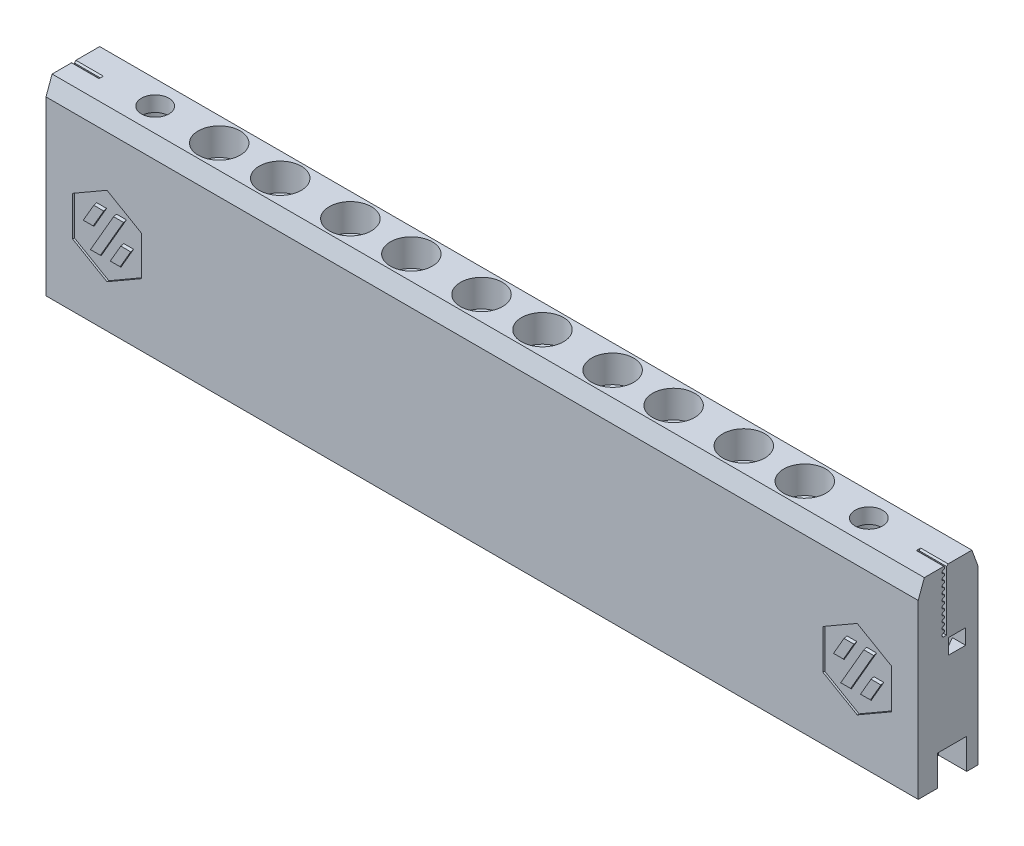
from build123d import *
from build123d.topology import SkipClean

# Parameters (mm, degrees)
SKIZZE1_W                        = 286
SKIZZE1_H                        = 19.6
SKIZZE1_R                        = 4.5
SKIZZE1_R_2                      = 4.2
AUFSATZ_LINEAR_AUSTRAGEN1_DEPTH  = 31
SKIZZE2_W                        = 9.2
SKIZZE2_H                        = 9.64
SCHNITT_LINEAR_AUSTRAGEN1_DEPTH  = 20
SKIZZE3_R                        = 1.65
SCHNITT_LINEAR_AUSTRAGEN2_DEPTH  = 11
FASE1_SIZE                       = 2
FASE1_SIZE2                      = 5.494954839
SKIZZE8_R                        = 6.9
SCHNITT_LINEAR_AUSTRAGEN6_DEPTH  = 9
SCHNITT_LINEAR_START             = -15
SCHNITT_LINEAR_AUSTRAGEN7_DEPTH  = 47
SKIZZE13_R                       = 7.65
SCHNITT_LINEAR_AUSTRAGEN10_DEPTH = 57
AUFSATZ_LINEAR_START             = -0.4
SKIZZE17_R                       = 4.2
AUFSATZ_LINEAR_AUSTRAGEN2_DEPTH  = 0.4
SKIZZE19_W                       = 9.2
SKIZZE19_H                       = 9.64
SKIZZE19_R                       = 1.65
AUFSATZ_LINEAR_AUSTRAGEN3_DEPTH  = 20
SCHNITT_LINEAR_AUSTRAGEN14_DEPTH = 9
SCHNITT_LINEAR_START_2           = -9
SCHNITT_LINEAR_AUSTRAGEN15_DEPTH = 9
SKIZZE25_R                       = 1.65
AUFSATZ_LINEAR_AUSTRAGEN4_DEPTH  = 17
SCHNITT_LINEAR_AUSTRAGEN16_DEPTH = 0.6
FASE2_SIZE                       = 0.6
FASE3_SIZE                       = 0.5
SKIZZE27_R                       = 2.25
SCHNITT_LINEAR_AUSTRAGEN17_DEPTH = 15
SKIZZE28_W                       = 9.2
SKIZZE28_H                       = 9.64
SKIZZE28_R                       = 1.65
AUFSATZ_LINEAR_AUSTRAGEN5_DEPTH  = 10
SCHNITT_LINEAR_START_3           = -3
SCHNITT_LINEAR_AUSTRAGEN18_DEPTH = 28
SCHNITT_LINEAR_AUSTRAGEN19_DEPTH = 5
AUFSATZ_LINEAR_START_2           = -4
SKIZZE31_R                       = 1.65
AUFSATZ_LINEAR_AUSTRAGEN6_DEPTH  = 4
FASE4_SIZE                       = 1.6


# Some blends are built 0.0001 mm under size
with BuildPart() as part:
    # Skizze1 → Aufsatz-Linear austragen1 (new body)
    with BuildSketch(Plane(origin=(0, 0, 0), x_dir=(1, 0, 0), z_dir=(0, 1, 0))):
        with Locations((143, 9.8)):
            Rectangle(SKIZZE1_W, SKIZZE1_H)
        with Locations(Location((26, 9.8, 0), (0, 0, 270))):
            Circle(SKIZZE1_R, mode=Mode.SUBTRACT)
        with Locations(Location((260, 9.8, 0), (0, 0, 90))):
            Circle(SKIZZE1_R, mode=Mode.SUBTRACT)
        with Locations(Location((47, 9.8, 0), (0, 0, 270))):
            Circle(SKIZZE1_R_2, mode=Mode.SUBTRACT)
        with Locations(Location((239, 9.8, 0), (0, 0, 90))):
            Circle(SKIZZE1_R_2, mode=Mode.SUBTRACT)
        with Locations(Location((67, 9.8, 0), (0, 0, 270))):
            Circle(SKIZZE1_R_2, mode=Mode.SUBTRACT)
        with Locations(Location((219, 9.8, 0), (0, 0, 90))):
            Circle(SKIZZE1_R_2, mode=Mode.SUBTRACT)
        with Locations(Location((90, 9.8, 0), (0, 0, 270))):
            Circle(SKIZZE1_R_2, mode=Mode.SUBTRACT)
        with Locations(Location((110, 9.8, 0), (0, 0, 270))):
            Circle(SKIZZE1_R_2, mode=Mode.SUBTRACT)
        with Locations(Location((133, 9.8, 0), (0, 0, 270))):
            Circle(SKIZZE1_R_2, mode=Mode.SUBTRACT)
        with Locations(Location((153, 9.8, 0), (0, 0, 90))):
            Circle(SKIZZE1_R_2, mode=Mode.SUBTRACT)
        with Locations(Location((176, 9.8, 0), (0, 0, 90))):
            Circle(SKIZZE1_R_2, mode=Mode.SUBTRACT)
        with Locations(Location((196, 9.8, 0), (0, 0, 90))):
            Circle(SKIZZE1_R_2, mode=Mode.SUBTRACT)
    aufsatz_linear_austragen1 = extrude(amount=AUFSATZ_LINEAR_AUSTRAGEN1_DEPTH)

    # Skizze2 → Schnitt-Linear austragen1 (cut)
    with BuildSketch(Plane(origin=(0, 31, 0), x_dir=(1, 0, 0), z_dir=(0, 1, 0))):
        with Locations((4.6, 11.08)):
            Rectangle(SKIZZE2_W, SKIZZE2_H)
        with Locations((281.4, 11.08)):
            Rectangle(SKIZZE2_W, SKIZZE2_H)
    schnitt_linear_austragen1 = extrude(amount=-SCHNITT_LINEAR_AUSTRAGEN1_DEPTH, mode=Mode.SUBTRACT)

    # Skizze3 → Schnitt-Linear austragen2 (cut)
    with BuildSketch(Plane(origin=(0, 11, 0), x_dir=(1, 0, 0), z_dir=(0, 1, 0))):
        with Locations(Location((6, 12.7, 0), (0, 0, 270))):
            Circle(SKIZZE3_R)
        with Locations(Location((280, 12.7, 0), (0, 0, 90))):
            Circle(SKIZZE3_R)
    schnitt_linear_austragen2 = extrude(amount=-SCHNITT_LINEAR_AUSTRAGEN2_DEPTH, mode=Mode.SUBTRACT)

    # Spiegeln3: Aufsatz-Linear austragen1, Schnitt-Linear austragen1, Schnitt-Linear austragen2 across plane
    add(aufsatz_linear_austragen1.mirror(Plane(origin=(0, 0, -19.6), x_dir=(0, 0, 1), z_dir=(0, -1, 0))))
    add(schnitt_linear_austragen1.mirror(Plane(origin=(0, 0, -19.6), x_dir=(0, 0, 1), z_dir=(0, -1, 0))), mode=Mode.SUBTRACT)
    add(schnitt_linear_austragen2.mirror(Plane(origin=(0, 0, -19.6), x_dir=(0, 0, 1), z_dir=(0, -1, 0))), mode=Mode.SUBTRACT)

    # Fase1
    fase1_edges = [part.edges().sort_by_distance(p)[0] for p in [
        (143, 31, -19.6),
        (143, 31, 0),
    ]]
    fase1_side = [part.faces().sort_by_distance(p)[0] for p in [
        (143, 31, -9.75216974),
    ]]
    chamfer(fase1_edges, length=FASE1_SIZE, length2=FASE1_SIZE2, reference=fase1_side[0])

    # Skizze8 → Schnitt-Linear austragen6 (cut)
    with BuildSketch(Plane(origin=(0, 31, 0), x_dir=(1, 0, 0), z_dir=(0, 1, 0))):
        with Locations(Location((47, 9.8, 0), (0, 0, 270))):
            Circle(SKIZZE8_R)
        with Locations(Location((67, 9.8, 0), (0, 0, 270))):
            Circle(SKIZZE8_R)
        with Locations(Location((219, 9.8, 0), (0, 0, 270))):
            Circle(SKIZZE8_R)
        with Locations(Location((239, 9.8, 0), (0, 0, 270))):
            Circle(SKIZZE8_R)
        with Locations(Location((90, 9.8, 0), (0, 0, 270))):
            Circle(SKIZZE8_R)
        with Locations(Location((110, 9.8, 0), (0, 0, 270))):
            Circle(SKIZZE8_R)
        with Locations(Location((133, 9.8, 0), (0, 0, 270))):
            Circle(SKIZZE8_R)
        with Locations(Location((153, 9.8, 0), (0, 0, 270))):
            Circle(SKIZZE8_R)
        with Locations(Location((176, 9.8, 0), (0, 0, 270))):
            Circle(SKIZZE8_R)
        with Locations(Location((196, 9.8, 0), (0, 0, 270))):
            Circle(SKIZZE8_R)
    extrude(amount=-SCHNITT_LINEAR_AUSTRAGEN6_DEPTH, mode=Mode.SUBTRACT)

    # Skizze9 → Schnitt-Linear austragen7 (cut)
    with BuildSketch(Plane(origin=(0, 31, 0), x_dir=(1, 0, 0), z_dir=(0, 1, 0)).offset(SCHNITT_LINEAR_START)):
        Polygon((42.092522712, 18.3), (71.907477288, 18.3), (76.814954576, 9.8), (71.907477288, 1.3), (42.092522712, 1.3), (37.185045424, 9.8), align=None)
        Polygon((85.092522712, 18.3), (114.907477288, 18.3), (119.814954576, 9.8), (114.907477288, 1.3), (85.092522712, 1.3), (80.185045424, 9.8), align=None)
        Polygon((214.092522712, 18.3), (243.907477288, 18.3), (248.814954576, 9.8), (243.907477288, 1.3), (214.092522712, 1.3), (209.185045424, 9.8), align=None)
        Polygon((128.092522712, 18.3), (157.907477288, 18.3), (162.814954576, 9.8), (157.907477288, 1.3), (128.092522712, 1.3), (123.185045424, 9.8), align=None)
        Polygon((171.092522712, 18.3), (200.907477288, 18.3), (205.814954576, 9.8), (200.907477288, 1.3), (171.092522712, 1.3), (166.185045424, 9.8), align=None)
    extrude(amount=-SCHNITT_LINEAR_AUSTRAGEN7_DEPTH, mode=Mode.SUBTRACT)

    # Skizze13 → Schnitt-Linear austragen10 (cut)
    with BuildSketch(Plane.XZ.offset(31)):
        with Locations(Location((26, -9.8, 0), (0, 0, 270))):
            Circle(SKIZZE13_R)
        with Locations(Location((260, -9.8, 0), (0, 0, 270))):
            Circle(SKIZZE13_R)
    extrude(amount=-SCHNITT_LINEAR_AUSTRAGEN10_DEPTH, mode=Mode.SUBTRACT)

    # Skizze17 → Aufsatz-Linear austragen2 (add)
    with BuildSketch(Plane(origin=(0, 22, 0), x_dir=(1, 0, 0), z_dir=(0, 1, 0)).offset(AUFSATZ_LINEAR_START)):
        with Locations(Location((47, 9.8, 0), (0, 0, 90))):
            Circle(SKIZZE17_R)
        with Locations(Location((67, 9.8, 0), (0, 0, 90))):
            Circle(SKIZZE17_R)
        with Locations(Location((90, 9.8, 0), (0, 0, 90))):
            Circle(SKIZZE17_R)
        with Locations(Location((110, 9.8, 0), (0, 0, 90))):
            Circle(SKIZZE17_R)
        with Locations(Location((133, 9.8, 0), (0, 0, 90))):
            Circle(SKIZZE17_R)
        with Locations(Location((153, 9.8, 0), (0, 0, 90))):
            Circle(SKIZZE17_R)
        with Locations(Location((176, 9.8, 0), (0, 0, 90))):
            Circle(SKIZZE17_R)
        with Locations(Location((196, 9.8, 0), (0, 0, 90))):
            Circle(SKIZZE17_R)
        with Locations(Location((219, 9.8, 0), (0, 0, 90))):
            Circle(SKIZZE17_R)
        with Locations(Location((239, 9.8, 0), (0, 0, 90))):
            Circle(SKIZZE17_R)
    extrude(amount=AUFSATZ_LINEAR_AUSTRAGEN2_DEPTH)

    # Skizze19 → Aufsatz-Linear austragen3 (add)
    # profile 1 of 2: a face of its own
    with BuildSketch(Plane(origin=(0, 31, 0), x_dir=(1, 0, 0), z_dir=(0, 1, 0))):
        with Locations((4.6, 11.08)):
            Rectangle(SKIZZE19_W, SKIZZE19_H)
        with Locations(Location((6, 12.7, 0), (0, 0, 270))):
            Circle(SKIZZE19_R, mode=Mode.SUBTRACT)
    # profile 2 of 2: a face of its own
    with BuildSketch(Plane(origin=(0, 31, 0), x_dir=(1, 0, 0), z_dir=(0, 1, 0))):
        with Locations((281.4, 11.08)):
            Rectangle(SKIZZE19_W, SKIZZE19_H)
        with Locations(Location((280, 12.7, 0), (0, 0, 270))):
            Circle(SKIZZE19_R, mode=Mode.SUBTRACT)
    extrude(amount=-AUFSATZ_LINEAR_AUSTRAGEN3_DEPTH)

    # Skizze22 → Schnitt-Linear austragen14 (cut)
    with BuildSketch(Plane.ZY):
        with BuildLine():
            Line((-8.55, 28.31), (-8.55, 28.81))
            ThreePointArc((-8.55, 28.81), (-8.494350288, 28.944350288), (-8.36, 29))
            ThreePointArc((-8.36, 29), (-7.8, 29.56), (-8.36, 30.12))
            ThreePointArc((-8.36, 30.12), (-8.494350288, 30.175649712), (-8.55, 30.31))
            Line((-8.55, 30.31), (-8.55, 30.81))
            ThreePointArc((-8.55, 30.81), (-8.494350288, 30.944350288), (-8.36, 31))
            Line((-8.36, 31), (-9.3, 31))
            Line((-9.3, 31), (-9.3, 11))
            Line((-9.3, 11), (-8.36, 11))
            ThreePointArc((-8.36, 11), (-7.8, 11.56), (-8.36, 12.12))
            ThreePointArc((-8.36, 12.12), (-8.494350288, 12.175649712), (-8.55, 12.31))
            Line((-8.55, 12.31), (-8.55, 12.81))
            ThreePointArc((-8.55, 12.81), (-8.494350288, 12.944350288), (-8.36, 13))
            ThreePointArc((-8.36, 13), (-7.8, 13.56), (-8.36, 14.12))
            ThreePointArc((-8.36, 14.12), (-8.494350288, 14.175649712), (-8.55, 14.31))
            Line((-8.55, 14.31), (-8.55, 14.81))
            ThreePointArc((-8.55, 14.81), (-8.494350288, 14.944350288), (-8.36, 15))
            ThreePointArc((-8.36, 15), (-7.8, 15.56), (-8.36, 16.12))
            ThreePointArc((-8.36, 16.12), (-8.494350288, 16.175649712), (-8.55, 16.31))
            Line((-8.55, 16.31), (-8.55, 16.81))
            ThreePointArc((-8.55, 16.81), (-8.494350288, 16.944350288), (-8.36, 17))
            ThreePointArc((-8.36, 17), (-7.8, 17.56), (-8.36, 18.12))
            ThreePointArc((-8.36, 18.12), (-8.494350288, 18.175649712), (-8.55, 18.31))
            Line((-8.55, 18.31), (-8.55, 18.81))
            ThreePointArc((-8.55, 18.81), (-8.494350288, 18.944350288), (-8.36, 19))
            ThreePointArc((-8.36, 19), (-7.8, 19.56), (-8.36, 20.12))
            ThreePointArc((-8.36, 20.12), (-8.494350288, 20.175649712), (-8.55, 20.31))
            Line((-8.55, 20.31), (-8.55, 20.81))
            ThreePointArc((-8.55, 20.81), (-8.494350288, 20.944350288), (-8.36, 21))
            ThreePointArc((-8.36, 21), (-7.8, 21.56), (-8.36, 22.12))
            ThreePointArc((-8.36, 22.12), (-8.494350288, 22.175649712), (-8.55, 22.31))
            Line((-8.55, 22.31), (-8.55, 22.81))
            ThreePointArc((-8.55, 22.81), (-8.494350288, 22.944350288), (-8.36, 23))
            ThreePointArc((-8.36, 23), (-7.8, 23.56), (-8.36, 24.12))
            ThreePointArc((-8.36, 24.12), (-8.494350288, 24.175649712), (-8.55, 24.31))
            Line((-8.55, 24.31), (-8.55, 24.81))
            ThreePointArc((-8.55, 24.81), (-8.494350288, 24.944350288), (-8.36, 25))
            ThreePointArc((-8.36, 25), (-7.8, 25.56), (-8.36, 26.12))
            ThreePointArc((-8.36, 26.12), (-8.494350288, 26.175649712), (-8.55, 26.31))
            Line((-8.55, 26.31), (-8.55, 26.81))
            ThreePointArc((-8.55, 26.81), (-8.494350288, 26.944350288), (-8.36, 27))
            ThreePointArc((-8.36, 27), (-7.8, 27.56), (-8.36, 28.12))
            ThreePointArc((-8.36, 28.12), (-8.494350288, 28.175649712), (-8.55, 28.31))
        make_face()
    extrude(amount=-SCHNITT_LINEAR_AUSTRAGEN14_DEPTH, mode=Mode.SUBTRACT)

    # Skizze23 → Schnitt-Linear austragen15 (cut)
    with BuildSketch(Plane(origin=(286, 0, 0), x_dir=(0, 0, -1), z_dir=(1, 0, 0)).offset(SCHNITT_LINEAR_START_2)):
        with BuildLine():
            Line((8.55, 30.81), (8.55, 30.31))
            ThreePointArc((8.55, 30.31), (8.494350288, 30.175649712), (8.36, 30.12))
            ThreePointArc((8.36, 30.12), (7.8, 29.56), (8.36, 29))
            ThreePointArc((8.36, 29), (8.494350288, 28.944350288), (8.55, 28.81))
            Line((8.55, 28.81), (8.55, 28.31))
            ThreePointArc((8.55, 28.31), (8.494350288, 28.175649712), (8.36, 28.12))
            ThreePointArc((8.36, 28.12), (7.8, 27.56), (8.36, 27))
            ThreePointArc((8.36, 27), (8.494350288, 26.944350288), (8.55, 26.81))
            Line((8.55, 26.81), (8.55, 26.31))
            ThreePointArc((8.55, 26.31), (8.494350288, 26.175649712), (8.36, 26.12))
            ThreePointArc((8.36, 26.12), (7.8, 25.56), (8.36, 25))
            ThreePointArc((8.36, 25), (8.494350288, 24.944350288), (8.55, 24.81))
            Line((8.55, 24.81), (8.55, 24.31))
            ThreePointArc((8.55, 24.31), (8.494350288, 24.175649712), (8.36, 24.12))
            ThreePointArc((8.36, 24.12), (7.8, 23.56), (8.36, 23))
            ThreePointArc((8.36, 23), (8.494350288, 22.944350288), (8.55, 22.81))
            Line((8.55, 22.81), (8.55, 22.31))
            ThreePointArc((8.55, 22.31), (8.494350288, 22.175649712), (8.36, 22.12))
            ThreePointArc((8.36, 22.12), (7.8, 21.56), (8.36, 21))
            ThreePointArc((8.36, 21), (8.494350288, 20.944350288), (8.55, 20.81))
            Line((8.55, 20.81), (8.55, 20.31))
            ThreePointArc((8.55, 20.31), (8.494350288, 20.175649712), (8.36, 20.12))
            ThreePointArc((8.36, 20.12), (7.8, 19.56), (8.36, 19))
            ThreePointArc((8.36, 19), (8.494350288, 18.944350288), (8.55, 18.81))
            Line((8.55, 18.81), (8.55, 18.31))
            ThreePointArc((8.55, 18.31), (8.494350288, 18.175649712), (8.36, 18.12))
            ThreePointArc((8.36, 18.12), (7.8, 17.56), (8.36, 17))
            ThreePointArc((8.36, 17), (8.494350288, 16.944350288), (8.55, 16.81))
            Line((8.55, 16.81), (8.55, 16.31))
            ThreePointArc((8.55, 16.31), (8.494350288, 16.175649712), (8.36, 16.12))
            ThreePointArc((8.36, 16.12), (7.8, 15.56), (8.36, 15))
            ThreePointArc((8.36, 15), (8.494350288, 14.944350288), (8.55, 14.81))
            Line((8.55, 14.81), (8.55, 14.31))
            ThreePointArc((8.55, 14.31), (8.494350288, 14.175649712), (8.36, 14.12))
            ThreePointArc((8.36, 14.12), (7.8, 13.56), (8.36, 13))
            ThreePointArc((8.36, 13), (8.494350288, 12.944350288), (8.55, 12.81))
            Line((8.55, 12.81), (8.55, 12.31))
            ThreePointArc((8.55, 12.31), (8.494350288, 12.175649712), (8.36, 12.12))
            ThreePointArc((8.36, 12.12), (7.8, 11.56), (8.36, 11))
            Line((8.36, 11), (9.3, 11))
            Line((9.3, 11), (9.3, 31))
            Line((9.3, 31), (8.36, 31))
            ThreePointArc((8.36, 31), (8.494350288, 30.944350288), (8.55, 30.81))
        make_face()
    extrude(amount=SCHNITT_LINEAR_AUSTRAGEN15_DEPTH, mode=Mode.SUBTRACT)

    # Skizze25 → Aufsatz-Linear austragen4 (add)
    with BuildSketch(Plane(origin=(0, 31, 0), x_dir=(1, 0, 0), z_dir=(0, 1, 0))):
        with Locations(Location((6, 12.7, 0), (0, 0, 270))):
            Circle(SKIZZE25_R)
        with Locations(Location((280, 12.7, 0), (0, 0, 90))):
            Circle(SKIZZE25_R)
    extrude(amount=-AUFSATZ_LINEAR_AUSTRAGEN4_DEPTH)

    # Skizze26 → Schnitt-Linear austragen16 (cut)
    # profile 1 of 2: a face of its own
    with BuildSketch(Plane.XY):
        Polygon((31.25, 2.495190528), (20, 8.990381057), (8.75, 2.495190528), (8.75, -10.495190528), (20, -16.990381057), (31.25, -10.495190528), align=None)
        Polygon((22.5159138, 3.170190528), (25.763509064, 3.170190528), (17.4840862, -11.170190528), (14.236490936, -11.170190528), align=None, mode=Mode.SUBTRACT)
        Polygon((16.020723271, 3.170190528), (19.268318535, 3.170190528), (15.128607104, -4), (11.88101184, -4), align=None, mode=Mode.SUBTRACT)
        Polygon((24.871392896, -4), (20.731681465, -11.170190528), (23.979276729, -11.170190528), (28.11898816, -4), align=None, mode=Mode.SUBTRACT)
    # profile 2 of 2: a face of its own
    with BuildSketch(Plane.XY):
        Polygon((277.25, 2.495190528), (266, 8.990381057), (254.75, 2.495190528), (254.75, -10.495190528), (266, -16.990381057), (277.25, -10.495190528), align=None)
        Polygon((268.5159138, 3.170190528), (271.763509064, 3.170190528), (263.4840862, -11.170190528), (260.236490936, -11.170190528), align=None, mode=Mode.SUBTRACT)
        Polygon((262.020723271, 3.170190528), (265.268318535, 3.170190528), (261.128607104, -4), (257.88101184, -4), align=None, mode=Mode.SUBTRACT)
        Polygon((270.871392896, -4), (266.731681465, -11.170190528), (269.979276729, -11.170190528), (274.11898816, -4), align=None, mode=Mode.SUBTRACT)
    extrude(amount=-SCHNITT_LINEAR_AUSTRAGEN16_DEPTH, mode=Mode.SUBTRACT)

    # Fase2
    fase2_edges = [part.edges().sort_by_distance(p)[0] for p in [
        (261.860288568, -11.170190528, 0),
        (268.355479097, -11.170190528, 0),
        (272.495190528, -4, 0),
        (270.139711432, 3.170190528, 0),
        (263.644520903, 3.170190528, 0),
        (259.504809472, -4, 0),
        (26.495190528, -4, 0),
        (22.355479097, -11.170190528, 0),
        (15.860288568, -11.170190528, 0),
        (24.139711432, 3.170190528, 0),
        (17.644520903, 3.170190528, 0),
        (13.504809472, -4, 0),
    ]]
    chamfer(fase2_edges, length=FASE2_SIZE - 0.0001)  # a hair under: the kernel refuses the full size

    # Fase3
    fase3_edges = [part.edges().sort_by_distance(p)[0] for p in [
        (4.5, 31, -9.3),
        (281.5, 31, -9.3),
    ]]
    chamfer(fase3_edges, length=FASE3_SIZE)

    # Skizze27 → Schnitt-Linear austragen17 (cut)
    with BuildSketch(Plane.XZ.offset(31)):
        with Locations(Location((14, -5.8, 0), (0, 0, 270))):
            Circle(SKIZZE27_R)
        with Locations(Location((272, -13.8, 0), (0, 0, 270))):
            Circle(SKIZZE27_R)
        with Locations(Location((78.5, -13.8, 0), (0, 0, 270))):
            Circle(SKIZZE27_R)
        with Locations(Location((121.5, -5.8, 0), (0, 0, 270))):
            Circle(SKIZZE27_R)
        with Locations(Location((164.5, -13.8, 0), (0, 0, 270))):
            Circle(SKIZZE27_R)
        with Locations(Location((207.5, -5.8, 0), (0, 0, 270))):
            Circle(SKIZZE27_R)
    extrude(amount=-SCHNITT_LINEAR_AUSTRAGEN17_DEPTH, mode=Mode.SUBTRACT)

    # Skizze28 → Aufsatz-Linear austragen5 (add)
    # profile 1 of 2: a face of its own
    with SkipClean():  # the faces are left unmerged after this step: merging them gives an invalid solid
        with BuildSketch(Plane.XZ.offset(11)):
            with Locations((4.6, -11.08)):
                Rectangle(SKIZZE28_W, SKIZZE28_H)
            with Locations(Location((6, -12.7, 0), (0, 0, 270))):
                Circle(SKIZZE28_R, mode=Mode.SUBTRACT)
        # profile 2 of 2: a face of its own
        with BuildSketch(Plane.XZ.offset(11)):
            with Locations((281.4, -11.08)):
                Rectangle(SKIZZE28_W, SKIZZE28_H)
            with Locations(Location((280, -12.7, 0), (0, 0, 270))):
                Circle(SKIZZE28_R, mode=Mode.SUBTRACT)
        extrude(amount=AUFSATZ_LINEAR_AUSTRAGEN5_DEPTH)

    # Skizze29 → Schnitt-Linear austragen18 (cut)
    with BuildSketch(Plane.XZ.offset(21).offset(SCHNITT_LINEAR_START_3)):
        Polygon((4.354551733, -9.85), (2.709103466, -12.7), (4.354551733, -15.55), (7.645448267, -15.55), (9.290896534, -12.7), (7.645448267, -9.85), align=None)
        Polygon((278.354551733, -9.85), (281.645448267, -9.85), (283.290896534, -12.7), (281.645448267, -15.55), (278.354551733, -15.55), (276.709103466, -12.7), align=None)
    extrude(amount=-SCHNITT_LINEAR_AUSTRAGEN18_DEPTH, mode=Mode.SUBTRACT)

    # Skizze30 → Schnitt-Linear austragen19 (cut)
    with BuildSketch(Plane.XZ.offset(-10)):
        Polygon((4.354551733, -15.55), (0, -15.55), (0, -9.85), (4.354551733, -9.85), (2.709103466, -12.7), align=None)
        Polygon((281.645448267, -9.85), (286, -9.85), (286, -15.55), (281.645448267, -15.55), (283.290896534, -12.7), align=None)
    extrude(amount=SCHNITT_LINEAR_AUSTRAGEN19_DEPTH, mode=Mode.SUBTRACT)

    # Skizze31 → Aufsatz-Linear austragen6 (add)
    with BuildSketch(Plane.XZ.offset(-10).offset(AUFSATZ_LINEAR_START_2)):
        with Locations(Location((6, -12.7, 0), (0, 0, 270))):
            Circle(SKIZZE31_R)
        with Locations(Location((280, -12.7, 0), (0, 0, 90))):
            Circle(SKIZZE31_R)
    extrude(amount=AUFSATZ_LINEAR_AUSTRAGEN6_DEPTH)

    # Fase4
    # the kernel refuses this chamfer: 1.6 mm, written as the material it takes off along each edge
    with BuildSketch(Plane(origin=(6, -18, -12.7), x_dir=(0, 0, -1), z_dir=(1, 0, 0))) as fase4_piece_1_section:
        Polygon((1.65, -FASE4_SIZE), (1.65 + FASE4_SIZE, 0), (1.65, 0), align=None)
    fase4_piece_1 = revolve(axis=Axis((6, -18, -12.7), (0, 1, 0)), mode=Mode.PRIVATE)
    fase4_piece_1 = split(fase4_piece_1, bisect_by=Plane(origin=(6, -18.783609932, -9.85), z_dir=(0, 0, -1)), keep=Keep.TOP, mode=Mode.PRIVATE)
    fase4_piece_1 = split(fase4_piece_1, bisect_by=Plane(origin=(6, -18.783609932, -15.55), z_dir=(0, 0, 1)), keep=Keep.TOP, mode=Mode.PRIVATE)
    fase4_piece_1 = split(fase4_piece_1, bisect_by=Plane(origin=(7.416275588, -18.783609932, -9.453061276), z_dir=(-0.8660254037844387, 0, -0.5000000000000003)), keep=Keep.TOP, mode=Mode.PRIVATE)
    fase4_piece_1 = split(fase4_piece_1, bisect_by=Plane(origin=(9.520069214, -18.783609932, -12.303061276), z_dir=(-0.8660254037844387, 0, 0.5000000000000003)), keep=Keep.TOP, mode=Mode.PRIVATE)
    fase4_piece_1 = split(fase4_piece_1, bisect_by=Plane(origin=(4.583724412, -18.783609932, -9.453061276), z_dir=(0.8660254037844384, 0, -0.5000000000000004)), keep=Keep.TOP, mode=Mode.PRIVATE)
    fase4_piece_1 = split(fase4_piece_1, bisect_by=Plane(origin=(2.479930786, -18.783609932, -12.303061276), z_dir=(0.8660254037844384, 0, 0.5000000000000004)), keep=Keep.TOP, mode=Mode.PRIVATE)
    add(fase4_piece_1, mode=Mode.SUBTRACT)
    with BuildSketch(Plane(origin=(280, -18, -12.7), x_dir=(0, 0, -1), z_dir=(1, 0, 0))) as fase4_piece_2_section:
        Polygon((1.65, -FASE4_SIZE), (1.65 + FASE4_SIZE, 0), (1.65, 0), align=None)
    fase4_piece_2 = revolve(axis=Axis((280, -18, -12.7), (0, 1, 0)), mode=Mode.PRIVATE)
    fase4_piece_2 = split(fase4_piece_2, bisect_by=Plane(origin=(280, -18.783609932, -15.55), z_dir=(0, 0, 1)), keep=Keep.TOP, mode=Mode.PRIVATE)
    fase4_piece_2 = split(fase4_piece_2, bisect_by=Plane(origin=(280, -18.783609932, -9.85), z_dir=(0, 0, -1)), keep=Keep.TOP, mode=Mode.PRIVATE)
    fase4_piece_2 = split(fase4_piece_2, bisect_by=Plane(origin=(276.479930786, -18.783609932, -12.303061276), z_dir=(0.8660254037844392, 0, 0.49999999999999917)), keep=Keep.TOP, mode=Mode.PRIVATE)
    fase4_piece_2 = split(fase4_piece_2, bisect_by=Plane(origin=(278.583724412, -18.783609932, -9.453061276), z_dir=(0.866025403784439, 0, -0.4999999999999994)), keep=Keep.TOP, mode=Mode.PRIVATE)
    fase4_piece_2 = split(fase4_piece_2, bisect_by=Plane(origin=(283.520069214, -18.783609932, -12.303061276), z_dir=(-0.866025403784439, 0, 0.4999999999999994)), keep=Keep.TOP, mode=Mode.PRIVATE)
    fase4_piece_2 = split(fase4_piece_2, bisect_by=Plane(origin=(281.416275588, -18.783609932, -9.453061276), z_dir=(-0.8660254037844392, 0, -0.49999999999999917)), keep=Keep.TOP, mode=Mode.PRIVATE)
    add(fase4_piece_2, mode=Mode.SUBTRACT)


solid = part.part
